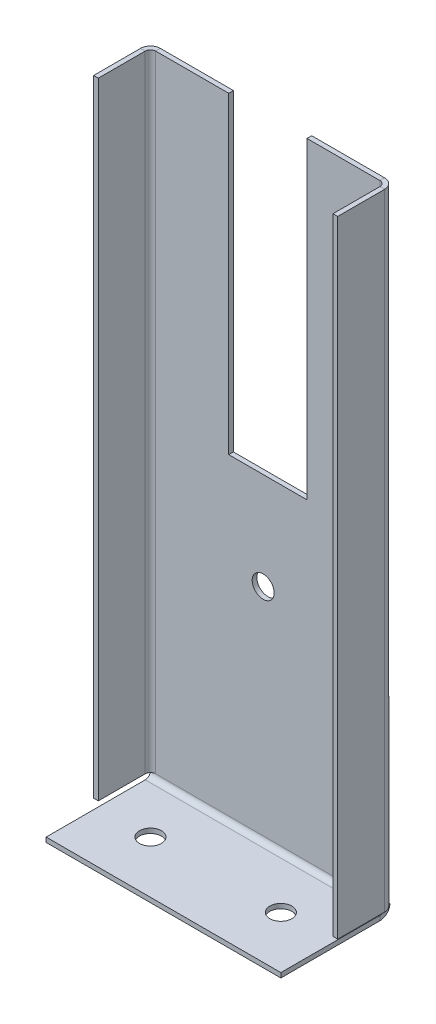
from build123d import *

# Parameters (mm, degrees)
SKETCH1_W                    = 45
SKETCH1_H                    = 120
BASE_FLANGE2_DEPTH           = 0.9
EDGE_FLANGE2_DEPTH           = 45
SKETCH17_W                   = 15
SKETCH17_H                   = 60
CUT_EXTRUDE1_DEPTH           = 10
EDGE_FLANGE4_STRIP_W         = 5.6
EDGE_FLANGE4_STRIP_H         = 0.9
EDGE_FLANGE4_STRIP_CUT_DEPTH = 120
EDGE_FLANGE4_DEPTH           = 120
EDGE_FLANGE5_STRIP_W         = 5.6
EDGE_FLANGE5_STRIP_H         = 0.9
EDGE_FLANGE5_STRIP_CUT_DEPTH = 120
EDGE_FLANGE5_DEPTH           = 120
F_19_0_166_DIAMETER_SLOT2_D  = 4.2164
F_19_0_166_DIAMETER_SLOT1_D  = 4.2164


# Sheet-metal steps are written as plain solids
with BuildPart() as part:
    # Sketch1 → Base-Flange2 (new body)
    with BuildSketch(Plane.XY):
        with Locations((4.162995595, 15.528634361)):
            Rectangle(SKETCH1_W, SKETCH1_H)
    extrude(amount=-BASE_FLANGE2_DEPTH)

    # Edge-Flange2 section (across the edge) → Edge-Flange2 (add)
    with BuildSketch(Plane(origin=(-18.337004405, -45.471365639, 0), x_dir=(0, 1, 0), z_dir=(1, 0, 0))):
        with BuildLine():
            Line((-0.9, 1), (-0.9, 20))
            Line((-0.9, 20), (0, 20))
            Line((0, 20), (0, 1))
            ThreePointArc((0, 1), (0.292893219, 0.292893219), (1, 0))
            Line((1, 0), (1, -0.9))
            ThreePointArc((1, -0.9), (-0.343502884, -0.343502884), (-0.9, 1))
        make_face()
    extrude(amount=EDGE_FLANGE2_DEPTH)

    # Sketch17 → Cut-Extrude1 (cut)
    with BuildSketch(Plane.XY):
        with Locations((4.162995595, 45.528634361)):
            Rectangle(SKETCH17_W, SKETCH17_H)
    extrude(amount=-CUT_EXTRUDE1_DEPTH, mode=Mode.SUBTRACT)

    # Edge-Flange4 strip (across the edge) → Edge-Flange4 strip cut (cut)
    with BuildSketch(Plane(origin=(-18.337004405, 75.528634361, 0), x_dir=(1, 0, 0), z_dir=(0, -1, 0))):
        with Locations((-1.8, -0.45)):
            Rectangle(EDGE_FLANGE4_STRIP_W, EDGE_FLANGE4_STRIP_H)
    extrude(amount=EDGE_FLANGE4_STRIP_CUT_DEPTH, mode=Mode.SUBTRACT)

    # Edge-Flange4 section (across the edge) → Edge-Flange4 (add)
    with BuildSketch(Plane(origin=(-18.337004405, 75.528634361, 0), x_dir=(1, 0, 0), z_dir=(0, -1, 0))):
        with BuildLine():
            Line((-0.9, 1), (-0.9, 10))
            Line((-0.9, 10), (0, 10))
            Line((0, 10), (0, 1))
            ThreePointArc((0, 1), (0.292893219, 0.292893219), (1, 0))
            Line((1, 0), (1, -0.9))
            ThreePointArc((1, -0.9), (-0.343502884, -0.343502884), (-0.9, 1))
        make_face()
    extrude(amount=EDGE_FLANGE4_DEPTH)

    # Edge-Flange5 strip (across the edge) → Edge-Flange5 strip cut (cut)
    with BuildSketch(Plane(origin=(26.662995595, -44.471365639, 0), x_dir=(-1, 0, 0), z_dir=(0, 1, 0))):
        with Locations((-1.8, -0.45)):
            Rectangle(EDGE_FLANGE5_STRIP_W, EDGE_FLANGE5_STRIP_H)
    extrude(amount=EDGE_FLANGE5_STRIP_CUT_DEPTH, mode=Mode.SUBTRACT)

    # Edge-Flange5 section (across the edge) → Edge-Flange5 (add)
    with BuildSketch(Plane(origin=(26.662995595, -44.471365639, 0), x_dir=(-1, 0, 0), z_dir=(0, 1, 0))):
        with BuildLine():
            Line((-0.9, 1), (-0.9, 10))
            Line((-0.9, 10), (0, 10))
            Line((0, 10), (0, 1))
            ThreePointArc((0, 1), (0.292893219, 0.292893219), (1, 0))
            Line((1, 0), (1, -0.9))
            ThreePointArc((1, -0.9), (-0.343502884, -0.343502884), (-0.9, 1))
        make_face()
    extrude(amount=EDGE_FLANGE5_DEPTH)

    # #19 (0.166) Diameter Slot2 (through all)
    with Locations(Plane(origin=(0, -45.471365639, 0), x_dir=(1, 0, 0), z_dir=(0, 1, 0))):
        with Locations((16.662995595, -10), (-8.337004405, -10)):
            Hole(F_19_0_166_DIAMETER_SLOT2_D / 2)

    # #19 (0.166) Diameter Slot1 (through all)
    with Locations(Plane.XY):
        with Locations((3.27299702, -3.085765259)):
            Hole(F_19_0_166_DIAMETER_SLOT1_D / 2)


solid = part.part
